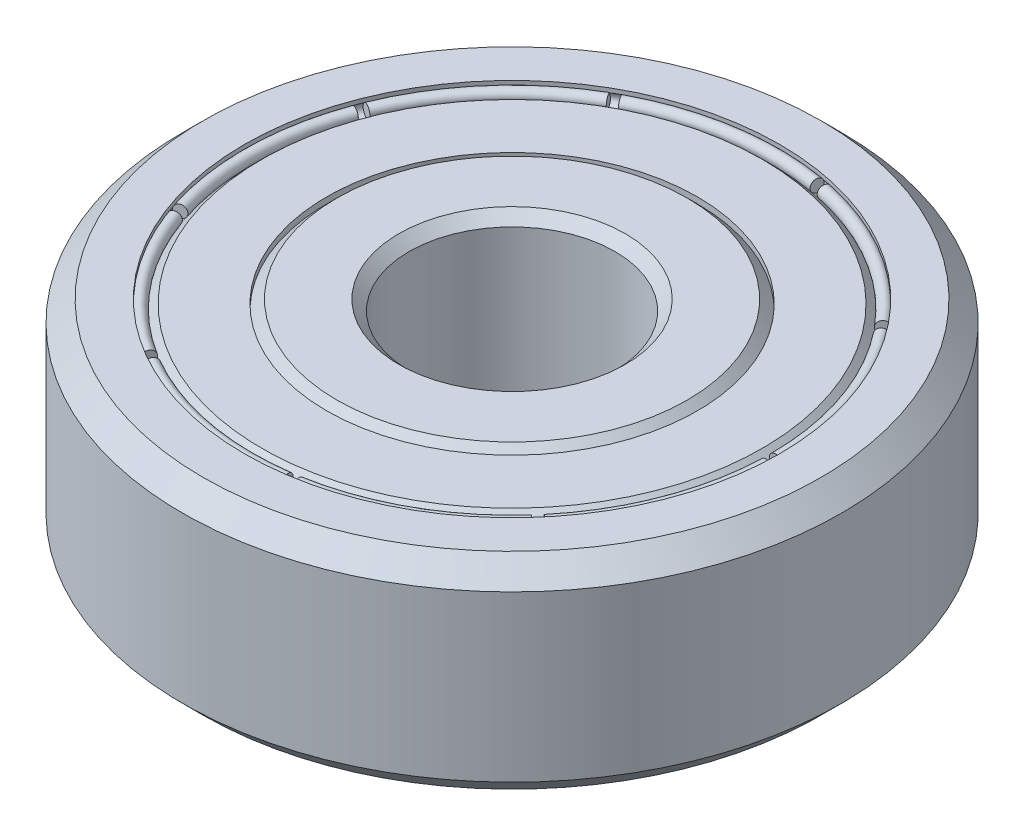
from build123d import *

# Parameters (mm, degrees)
SKETCH2_R         = 0.15
REVOLVE2_ANGLE    = 38
CIRPATTERN1_COUNT = 9


with BuildPart() as part:
    # Sketch1 → Revolve1 (revolve)
    with BuildSketch(Plane.XY):
        with BuildLine():
            Line((2.5, -2.25), (2.5, 2.25))
            Line((2.5, 2.25), (2.75, 2.5))
            Line((2.75, 2.5), (4.25, 2.5))
            Line((4.25, 2.5), (4.5, 2.25))
            Line((4.5, 2.25), (4.5, 2.4))
            Line((4.5, 2.4), (6.075735931, 2.4))
            Line((6.075735931, 2.4), (6.287867966, 2.187867966))
            ThreePointArc((6.287867966, 2.187867966), (6.5, 2.187867966), (6.5, 2.4))
            Line((6.5, 2.4), (6.5, 2.5))
            Line((6.5, 2.5), (7.5, 2.5))
            Line((7.5, 2.5), (8, 2))
            Line((8, 2), (8, -2))
            Line((8, -2), (7.5, -2.5))
            Line((7.5, -2.5), (6.5, -2.5))
            Line((6.5, -2.5), (6.5, -2.4))
            ThreePointArc((6.5, -2.4), (6.5, -2.187867966), (6.287867966, -2.187867966))
            Line((6.287867966, -2.187867966), (6.075735931, -2.4))
            Line((6.075735931, -2.4), (4.5, -2.4))
            Line((4.5, -2.4), (4.5, -2.25))
            Line((4.5, -2.25), (4.25, -2.5))
            Line((4.25, -2.5), (2.75, -2.5))
            Line((2.75, -2.5), (2.5, -2.25))
        make_face()
    revolve(axis=Axis((0, 0, 0), (0, 1, 0)))


with BuildPart() as body_2:
    # Sketch2 → Revolve2 (revolve)
    with BuildSketch(Plane.XY):
        with Locations((6.393933983, -2.293933983)):
            Circle(SKETCH2_R)
    revolve(axis=Axis((0, 0, 0), (0, 1, 0)), revolution_arc=REVOLVE2_ANGLE)


with BuildPart() as cirpattern1_1:
    # CirPattern1: pattern copy
    add(body_2.part.rotate(Axis((0, 0, 0), (0, -1, 0)), 1 * 360 / CIRPATTERN1_COUNT))


with BuildPart() as cirpattern1_2:
    # CirPattern1: pattern copy
    add(body_2.part.rotate(Axis((0, 0, 0), (0, -1, 0)), 2 * 360 / CIRPATTERN1_COUNT))


with BuildPart() as cirpattern1_3:
    # CirPattern1: pattern copy
    add(body_2.part.rotate(Axis((0, 0, 0), (0, -1, 0)), 3 * 360 / CIRPATTERN1_COUNT))


with BuildPart() as cirpattern1_4:
    # CirPattern1: pattern copy
    add(body_2.part.rotate(Axis((0, 0, 0), (0, -1, 0)), 4 * 360 / CIRPATTERN1_COUNT))


with BuildPart() as cirpattern1_5:
    # CirPattern1: pattern copy
    add(body_2.part.rotate(Axis((0, 0, 0), (0, -1, 0)), 5 * 360 / CIRPATTERN1_COUNT))


with BuildPart() as cirpattern1_6:
    # CirPattern1: pattern copy
    add(body_2.part.rotate(Axis((0, 0, 0), (0, -1, 0)), 6 * 360 / CIRPATTERN1_COUNT))


with BuildPart() as cirpattern1_7:
    # CirPattern1: pattern copy
    add(body_2.part.rotate(Axis((0, 0, 0), (0, -1, 0)), 7 * 360 / CIRPATTERN1_COUNT))


with BuildPart() as cirpattern1_8:
    # CirPattern1: pattern copy
    add(body_2.part.rotate(Axis((0, 0, 0), (0, -1, 0)), 8 * 360 / CIRPATTERN1_COUNT))


with BuildPart() as body_11:
    # Mirror1: mirrored copy
    add(body_2.part.mirror(Plane.ZX))


with BuildPart() as body_12:
    # Mirror1 2: mirrored copy
    add(cirpattern1_1.part.mirror(Plane.ZX))


with BuildPart() as body_13:
    # Mirror1 3: mirrored copy
    add(cirpattern1_2.part.mirror(Plane.ZX))


with BuildPart() as body_14:
    # Mirror1 4: mirrored copy
    add(cirpattern1_3.part.mirror(Plane.ZX))


with BuildPart() as body_15:
    # Mirror1 5: mirrored copy
    add(cirpattern1_4.part.mirror(Plane.ZX))


with BuildPart() as body_16:
    # Mirror1 6: mirrored copy
    add(cirpattern1_5.part.mirror(Plane.ZX))


with BuildPart() as body_17:
    # Mirror1 7: mirrored copy
    add(cirpattern1_6.part.mirror(Plane.ZX))


with BuildPart() as body_18:
    # Mirror1 8: mirrored copy
    add(cirpattern1_7.part.mirror(Plane.ZX))


with BuildPart() as body_19:
    # Mirror1 9: mirrored copy
    add(cirpattern1_8.part.mirror(Plane.ZX))


solid = Compound([part.part, body_2.part, cirpattern1_1.part, cirpattern1_2.part, cirpattern1_3.part, cirpattern1_4.part, cirpattern1_5.part, cirpattern1_6.part, cirpattern1_7.part, cirpattern1_8.part, body_11.part, body_12.part, body_13.part, body_14.part, body_15.part, body_16.part, body_17.part, body_18.part, body_19.part])
